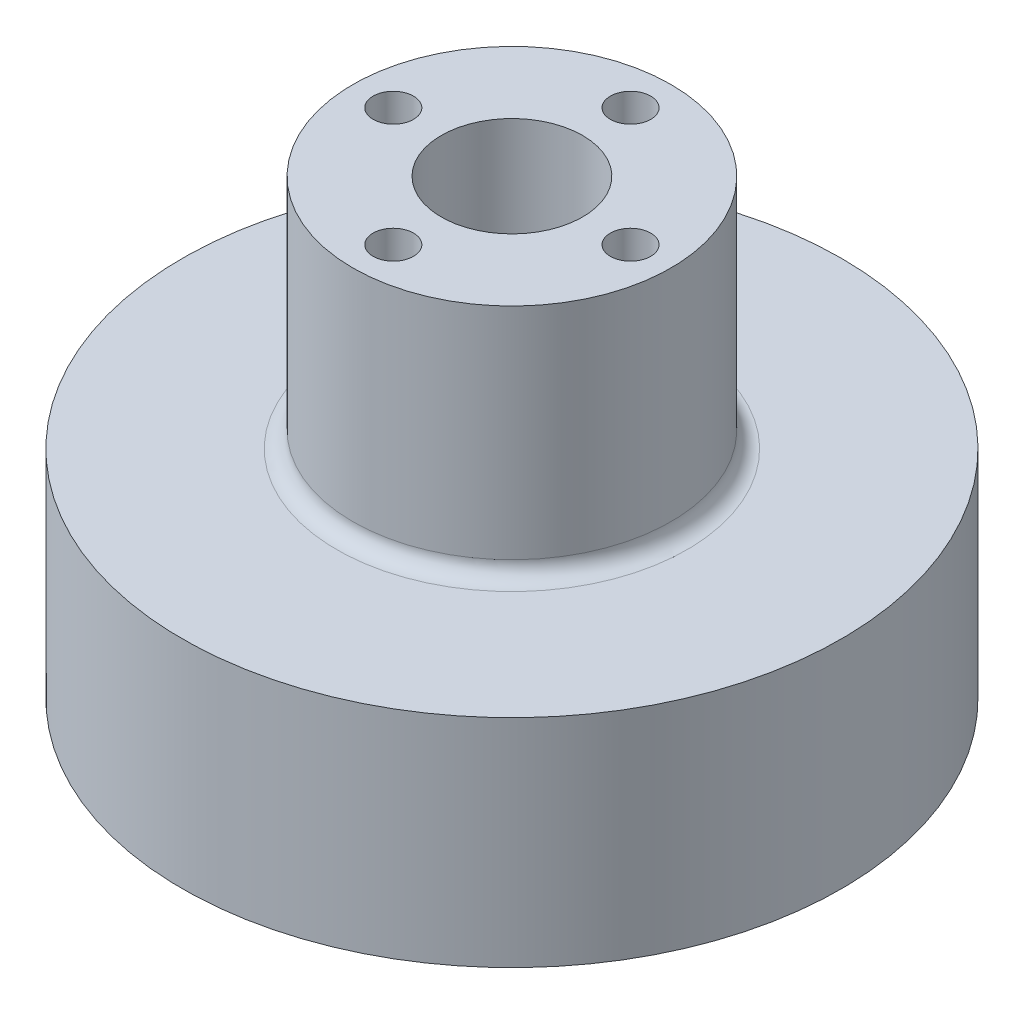
from build123d import *

# Parameters (mm, degrees)
F_1_8_0_125_DIAMETER_HOLE1_D     = 3.175
F_1_8_0_125_DIAMETER_HOLE1_DEPTH = 7.14375
F_1_8_0_125_DIAMETER_HOLE1_TIP   = 0.953866233


with BuildPart() as part:
    # Sketch1 → Revolve1 (revolve)
    with BuildSketch(Plane(origin=(0, 0, 0), x_dir=(0, 0, -1), z_dir=(1, 0, 0))):
        with BuildLine():
            Line((0, 0), (0, 17.018))
            Line((0, 17.018), (12.138, 17.018))
            ThreePointArc((12.138, 17.018), (13.036025612, 17.389974388), (13.408, 18.288))
            Line((13.408, 18.288), (13.408, 35.56))
            Line((13.408, 35.56), (20.35175, 35.56))
            Line((20.35175, 35.56), (20.35175, 26.67))
            Line((20.35175, 26.67), (22.6441, 26.67))
            Line((22.6441, 26.67), (22.6441, 20.447))
            Line((22.6441, 20.447), (20.35175, 20.447))
            Line((20.35175, 20.447), (20.35175, 13.843))
            Line((20.35175, 13.843), (1.0795, 13.843))
            Line((1.0795, 13.843), (1.0795, 0))
            Line((1.0795, 0), (0, 0))
        make_face()
    revolve(axis=Axis((0, 0, -25.908), (0, 1, 0)))

    # 1/8 (0.125) Diameter Hole1
    with Locations(Plane(origin=(0, 35.56, 0), x_dir=(1, 0, 0), z_dir=(0, 1, 0))):
        with Locations((9.325, 25.908), (0, 16.583), (-9.325, 25.908), (0, 35.233)):
            Hole(F_1_8_0_125_DIAMETER_HOLE1_D / 2, depth=F_1_8_0_125_DIAMETER_HOLE1_DEPTH)
            with Locations((0, 0, -(F_1_8_0_125_DIAMETER_HOLE1_DEPTH + F_1_8_0_125_DIAMETER_HOLE1_TIP / 2))):  # 118° drill point
                Cone(0, F_1_8_0_125_DIAMETER_HOLE1_D / 2, F_1_8_0_125_DIAMETER_HOLE1_TIP, mode=Mode.SUBTRACT)


solid = part.part
